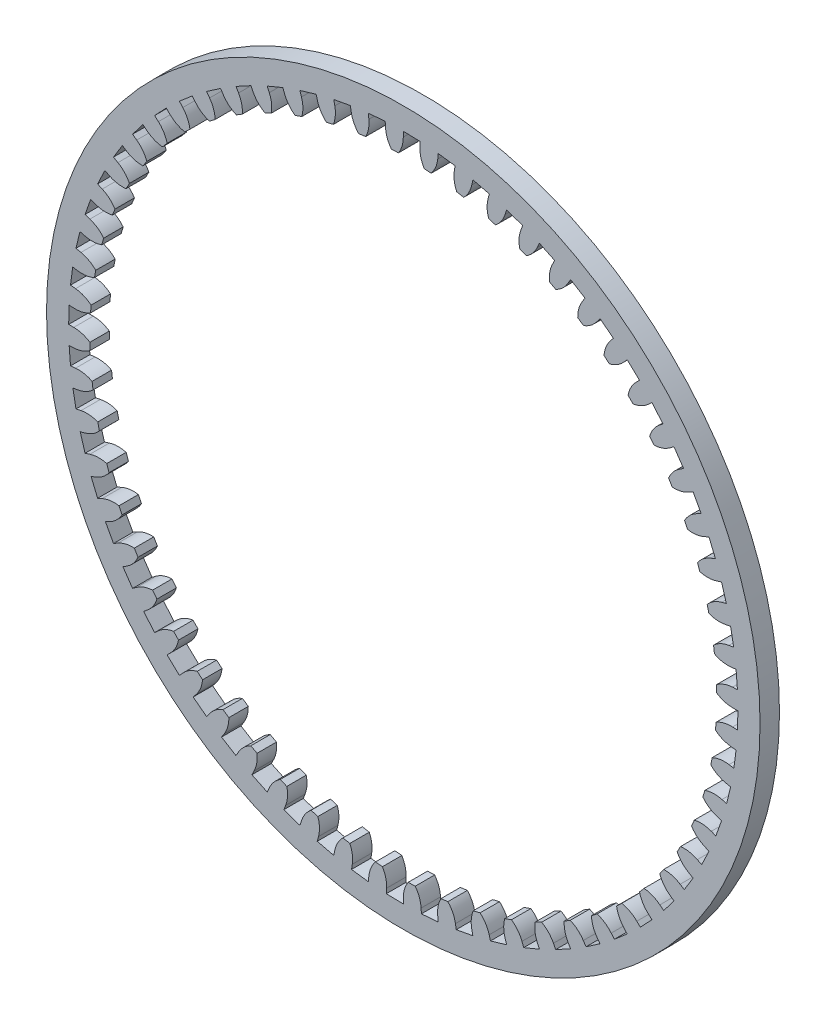
from build123d import *
from OCP.BRepFilletAPI import BRepFilletAPI_MakeChamfer

# Parameters (mm, degrees)
BOSS_EXTRUDE1_DEPTH = 4
CHAMFER1_SIZE       = 1
CHAMFER1_SIZE2      = 1.02816492
CHAMFER1_SIZE2_2    = 1.028164498
CHAMFER1_SIZE2_3    = 1.028165221
FILLET1_R           = 6
CIRPATTERN6_DEPTH   = 4


# Read off the part's stored shape, not the designer's step: CirPattern6
with BuildPart() as part:
    # Sketch2 → Boss-Extrude1 (new body)
    with BuildSketch(Plane.XY):
        with BuildLine():
            Line((0, 73.473375946), (0, 64.57))
            Line((0, 64.57), (-3.489128905, 64.47566114))
            Line((-3.489128905, 64.47566114), (-3.7236451, 68.809320351))
            Line((-3.7236451, 68.809320351), (-7.203054967, 68.532503961))
            Line((-7.203054967, 68.532503961), (-6.749402648, 64.216278808))
            Line((-6.749402648, 64.216278808), (-10.209556645, 63.757743476))
            Line((-10.209556645, 63.757743476), (-10.895780524, 68.043148566))
            Line((-10.895780524, 68.043148566), (-14.327194614, 67.404151167))
            Line((-14.327194614, 67.404151167), (-15.275973823, 71.867806399))
            ThreePointArc((-15.275973823, 71.867806399), (-7.680059079, 73.070881105), (0, 73.473375946))
        make_face()
    extrude(amount=BOSS_EXTRUDE1_DEPTH)

    # Chamfer1: one chamfer whose edges measure the first distance from different faces: ONE call of the kernel's chamfer builder (chamfer() names one face for all edges)
    chamfer1_edges_1 = [part.edges().sort_by_distance(p)[0] for p in [
        (0, 64.57, 2),
    ]]
    chamfer1_side_1 = [part.faces().sort_by_distance(p)[0] for p in [
        (-1.744564453, 64.52283057, 2),
    ]]
    chamfer1_edges_2 = [part.edges().sort_by_distance(p)[0] for p in [
        (-3.489128905, 64.47566114, 2),
    ]]
    chamfer1_side_2 = [part.faces().sort_by_distance(p)[0] for p in [
        (-3.606387002, 66.642490746, 2),
    ]]
    chamfer1_edges_3 = [part.edges().sort_by_distance(p)[0] for p in [
        (-6.749402648, 64.216278808, 2),
    ]]
    chamfer1_side_3 = [part.faces().sort_by_distance(p)[0] for p in [
        (-8.479479646, 63.987011142, 2),
    ]]
    chamfer1_edges_4 = [part.edges().sort_by_distance(p)[0] for p in [
        (-10.209556645, 63.757743476, 2),
    ]]
    chamfer1_side_4 = [part.faces().sort_by_distance(p)[0] for p in [
        (-10.552668584, 65.900446021, 2),
    ]]
    chamfer1 = BRepFilletAPI_MakeChamfer(part.part.solid().wrapped)
    for e in chamfer1_edges_1:
        chamfer1.Add(CHAMFER1_SIZE, CHAMFER1_SIZE2, e.wrapped, chamfer1_side_1[0].wrapped)  # the first distance lies on this face
    for e in chamfer1_edges_2:
        chamfer1.Add(CHAMFER1_SIZE, CHAMFER1_SIZE2_2, e.wrapped, chamfer1_side_2[0].wrapped)  # the first distance lies on this face
    for e in chamfer1_edges_3:
        chamfer1.Add(CHAMFER1_SIZE, CHAMFER1_SIZE2_3, e.wrapped, chamfer1_side_3[0].wrapped)  # the first distance lies on this face
    for e in chamfer1_edges_4:
        chamfer1.Add(CHAMFER1_SIZE, CHAMFER1_SIZE2, e.wrapped, chamfer1_side_4[0].wrapped)  # the first distance lies on this face
    add(Compound.cast(chamfer1.Shape()), mode=Mode.REPLACE)

    # Fillet1
    # the kernel refuses this fillet: 6 mm, written as the material it takes off along each edge
    with BuildSketch(Plane(origin=(0, 65.59816492, -5.652202484), x_dir=(0, 1, 0), z_dir=(0, 0, 1))) as fillet1_piece_1:
        with BuildLine():
            CenterArc((2.260880994, 6), FILLET1_R, 236.449001868, 33.550998132)
            Line((-1.055192983, 0.999634675), (-1.121514463, 0.899627369))
            ThreePointArc((-1.121514463, 0.899627369), (-0.610124899, 0.412702116), (-0.082528408, -0.087115222))
            Line((-0.082528408, -0.087115222), (0, -0.12))
            Line((0, -0.12), (2.260880994, -0.12))
            Line((2.260880994, -0.12), (2.260880994, 0))
        make_face()
    extrude(amount=15.304404968, mode=Mode.SUBTRACT)
    with BuildSketch(Plane(origin=(-3.543164895, 65.474200129, -5.825882404), x_dir=(0.7442829047789902, -0.6678644755141188, 0), z_dir=(0, 0, 1))) as fillet1_piece_2:
        with BuildLine():
            CenterArc((2.594832306, 5.890449069), FILLET1_R, 225, 34.034383283)
            Line((-1.647808382, 1.647808382), (-1.732661195, 1.562955568))
            Line((-1.732661195, 1.562955568), (-0.084852814, -0.084852814))
            Line((-0.084852814, -0.084852814), (0, -0.12))
            ThreePointArc((0, -0.12), (0.726756497, -0.12), (1.430686609, -0.117808981))
            Line((1.430686609, -0.117808981), (1.453512995, 0))
        make_face()
    extrude(amount=15.651764807, mode=Mode.SUBTRACT)
    with BuildSketch(Plane(origin=(-6.856874891, 65.238811662, -5.652201011), x_dir=(-0.10452818418191513, 0.9945219247013267, 0), z_dir=(0, 0, 1))) as fillet1_piece_3:
        with BuildLine():
            CenterArc((2.260880404, 6), FILLET1_R, 236.449001998, 33.550998002)
            Line((-1.055193561, 0.999634668), (-1.12151504, 0.899627361))
            ThreePointArc((-1.12151504, 0.899627361), (-0.610125164, 0.412702089), (-0.082528384, -0.087115245))
            Line((-0.082528384, -0.087115245), (0, -0.12))
            Line((0, -0.12), (2.260880404, -0.12))
            Line((2.260880404, -0.12), (2.260880404, 0))
        make_face()
    extrude(amount=15.304402022, mode=Mode.SUBTRACT)
    with BuildSketch(Plane(origin=(-10.367672746, 64.745164003, -5.825882897), x_dir=(-0.15811610105493576, 0.987420527732326, 0), z_dir=(0, 0, 1))) as fillet1_piece_4:
        with BuildLine():
            CenterArc((2.330353159, -6), FILLET1_R, 90, 34.034390293)
            Line((-1.027789306, -1.027789306), (-1.094952155, -0.928345092))
            ThreePointArc((-1.094952155, -0.928345092), (-0.598747467, -0.429041839), (-0.084852814, 0.084852814))
            Line((-0.084852814, 0.084852814), (0, 0.12))
            Line((0, 0.12), (2.330353159, 0.12))
            Line((2.330353159, 0.12), (2.330353159, 0))
        make_face()
    extrude(amount=15.651765795, mode=Mode.SUBTRACT)

    # CirPattern6 outline → CirPattern6 (add)
    with BuildSketch(Plane.XY):
        with BuildLine():
            ThreePointArc((-15.275973823, 71.867806399), (7.680059079, -73.070881105), (0, 73.473375946))
            Line((0, 73.473375946), (0, 68.91))
            Line((0, 68.91), (3.48928449, 68.821602668))
            Line((3.48928449, 68.821602668), (3.438160631, 67.813250996))
            ThreePointArc((3.438160631, 67.813250996), (3.611608516, 66.046249556), (4.294590654, 64.407373827))
            Line((4.294590654, 64.407373827), (5.752419325, 64.29388904))
            ThreePointArc((5.752419325, 64.29388904), (6.658243721, 65.791749408), (7.093202902, 67.487306553))
            Line((7.093202902, 67.487306553), (7.203057841, 68.532503659))
            Line((7.203057841, 68.532503659), (10.663987618, 68.079860958))
            Line((10.663987618, 68.079860958), (10.507741956, 67.082376905))
            ThreePointArc((10.507741956, 67.082376905), (10.495536995, 65.306925411), (11.003467608, 63.605636647))
            Line((11.003467608, 63.605636647), (12.441448167, 63.34038888))
            ThreePointArc((12.441448167, 63.34038888), (13.498879019, 64.735359681), (14.108688973, 66.376162949))
            Line((14.108688973, 66.376162949), (14.327194614, 67.404151167))
            Line((14.327194614, 67.404151167), (17.721851027, 66.59222249))
            Line((17.721851027, 66.59222249), (17.462196247, 65.616534969))
            ThreePointArc((17.462196247, 65.616534969), (17.264473622, 63.852084907), (17.591789537, 62.107022574))
            Line((17.591789537, 62.107022574), (18.994166341, 61.692918078))
            ThreePointArc((18.994166341, 61.692918078), (20.191618982, 62.969715122), (20.969599414, 64.537787176))
            Line((20.969599414, 64.537787176), (21.294362456, 65.537304091))
            Line((21.294362456, 65.537304091), (24.585552905, 64.374984958))
            Line((24.585552905, 64.374984958), (24.22533299, 63.431783625))
            ThreePointArc((24.22533299, 63.431783625), (23.844257614, 61.697667561), (23.987370901, 59.927951325))
            Line((23.987370901, 59.927951325), (25.338780023, 59.369526888))
            ThreePointArc((25.338780023, 59.369526888), (26.663134212, 60.514161994), (27.600760537, 61.992323154))
            Line((27.600760537, 61.992323154), (28.028222074, 62.952417486))
            Line((28.028222074, 62.952417486), (31.179887636, 61.452442645))
            Line((31.179887636, 61.452442645), (30.723050093, 60.552061501))
            ThreePointArc((30.723050093, 60.552061501), (30.162798387, 58.867277752), (30.120142804, 57.092296412))
            Line((30.120142804, 57.092296412), (31.405777144, 56.395670561))
            ThreePointArc((31.405777144, 56.395670561), (32.842523604, 57.395602123), (33.929523809, 58.767656813))
            Line((33.929523809, 58.767656813), (34.455001251, 59.677809852))
            Line((34.455001251, 59.677809852), (37.432611556, 57.85661321))
            Line((37.432611556, 57.85661321), (36.884160726, 57.00891702))
            ThreePointArc((36.884160726, 57.00891702), (36.150869759, 55.391925578), (35.922910982, 53.631126963))
            Line((35.922910982, 53.631126963), (37.128685603, 52.803931684))
            ThreePointArc((37.128685603, 52.803931684), (38.662082496, 53.648205048), (39.886546423, 54.899121366))
            Line((39.886546423, 54.899121366), (40.504281735, 55.749361082))
            Line((40.504281735, 55.749361082), (43.275213537, 53.626896174))
            Line((43.275213537, 53.626896174), (42.641159225, 52.841172385))
            ThreePointArc((42.641159225, 52.841172385), (41.742864125, 51.309688082), (41.332101297, 49.582362938))
            Line((41.332101297, 49.582362938), (42.444804783, 48.633661623))
            ThreePointArc((42.444804783, 48.633661623), (44.058052348, 49.313025896), (45.406565201, 50.429097849))
            Line((45.406565201, 50.429097849), (46.109791158, 51.210108957))
            Line((46.109791158, 51.210108957), (48.64368546, 48.809629837))
            Line((48.64368546, 48.809629837), (47.930973649, 48.094487183))
            ThreePointArc((47.930973649, 48.094487183), (46.877515423, 46.665290648), (46.288447476, 44.990365002))
            Line((46.288447476, 44.990365002), (47.29588946, 43.930551285))
            ThreePointArc((47.29588946, 43.930551285), (48.971312254, 44.437564109), (50.429098833, 45.406564539))
            Line((50.429098833, 45.406564539), (51.210109924, 46.109790084))
            Line((51.210109924, 46.109790084), (53.47920495, 43.457597011))
            Line((53.47920495, 43.457597011), (52.695645084, 42.820870475))
            ThreePointArc((52.695645084, 42.820870475), (51.498566396, 41.509618832), (50.73764863, 39.905442281))
            Line((50.73764863, 39.905442281), (51.628790781, 38.746128303))
            ThreePointArc((51.628790781, 38.746128303), (53.34803279, 39.075233807), (54.899121809, 39.886545323))
            Line((54.899121809, 39.886545323), (55.749361932, 40.504280567))
            Line((55.749361932, 40.504280567), (57.728796891, 37.629431427))
            Line((57.728796891, 37.629431427), (56.882973024, 37.078097473))
            ThreePointArc((56.882973024, 37.078097473), (55.555388721, 35.899158592), (54.630956698, 34.383308203))
            Line((54.630956698, 34.383308203), (55.396035996, 33.137194992))
            ThreePointArc((55.396035996, 33.137194992), (57.140260676, 33.284788384), (58.767657638, 33.929522957))
            Line((58.767657638, 33.929522957), (59.677810575, 34.455))
            Line((59.677810575, 34.455), (61.345898484, 31.388992325))
            Line((61.345898484, 31.388992325), (60.447078391, 30.929091049))
            ThreePointArc((60.447078391, 30.929091049), (59.003534198, 29.895380054), (57.925717252, 28.484462308))
            Line((57.925717252, 28.484462308), (58.556350879, 27.165203251))
            ThreePointArc((58.556350879, 27.165203251), (60.306448208, 27.129666497), (61.992323359, 27.60075937))
            Line((61.992323359, 27.60075937), (62.952418074, 28.028220754))
            Line((62.952418074, 28.028220754), (64.290882885, 24.804646296))
            Line((64.290882885, 24.804646296), (63.348913524, 24.441216982))
            ThreePointArc((63.348913524, 24.441216982), (61.805224947, 23.564061042), (60.585830964, 22.273535846))
            Line((60.585830964, 22.273535846), (61.075109939, 20.895584268))
            ThreePointArc((61.075109939, 20.895584268), (62.811905516, 20.677307687), (64.537787806, 20.969598409))
            Line((64.537787806, 20.969598409), (65.537304538, 21.294361082))
            Line((65.537304538, 21.294361082), (66.531481884, 17.948538053))
            Line((66.531481884, 17.948538053), (65.556684315, 17.685561929))
            ThreePointArc((65.556684315, 17.685561929), (63.929764425, 16.974569714), (62.582154071, 15.818574649))
            Line((62.582154071, 15.818574649), (62.92471746, 14.397028464))
            ThreePointArc((62.92471746, 14.397028464), (64.629182456, 13.998402579), (66.376162906, 14.108687789))
            Line((66.376162906, 14.108687789), (67.404151467, 14.327193201))
            Line((67.404151467, 14.327193201), (68.043148794, 10.895779097))
            Line((68.043148794, 10.895779097), (67.046202521, 10.736138028))
            ThreePointArc((67.046202521, 10.736138028), (65.353876268, 10.199100952), (63.892813694, 9.190303092))
            Line((63.892813694, 9.190303092), (64.084908507, 7.740736243))
            ThreePointArc((64.084908507, 7.740736243), (65.738368681, 7.166129425), (67.48730696, 7.093201788))
            Line((67.48730696, 7.093201788), (68.53250381, 7.203056404))
            Line((68.53250381, 7.203056404), (68.809320273, 3.723646542))
            Line((68.809320273, 3.723646542), (67.801148558, 3.669088888))
            ThreePointArc((67.801148558, 3.669088888), (66.061957178, 3.311889224), (64.503450455, 2.461339372))
            Line((64.503450455, 2.461339372), (64.542971941, 0.999634448))
            ThreePointArc((64.542971941, 0.999634448), (66.127311306, 0.255341296), (67.859045625, -1.15e-06))
            Line((67.859045625, -1.15e-06), (68.91, -1.445e-06))
            Line((68.91, -1.445e-06), (68.821602595, -3.489285932))
            Line((68.821602595, -3.489285932), (67.813250745, -3.438161676))
            ThreePointArc((67.813250745, -3.438161676), (66.046249594, -3.611608791), (64.407373874, -4.294590007))
            Line((64.407373874, -4.294590007), (64.29388906, -5.752419099))
            ThreePointArc((64.29388906, -5.752419099), (65.791749687, -6.658243081), (67.48730696, -7.093201788))
            Line((67.48730696, -7.093201788), (68.53250381, -7.203056404))
            Line((68.53250381, -7.203056404), (68.079861182, -10.663986191))
            Line((68.079861182, -10.663986191), (67.082377264, -10.507740944))
            ThreePointArc((67.082377264, -10.507740944), (65.306925402, -10.495536718), (63.605636532, -11.003468246))
            Line((63.605636532, -11.003468246), (63.340388836, -12.441448389))
            ThreePointArc((63.340388836, -12.441448389), (64.735359337, -13.498879627), (66.376162428, -14.108690038))
            Line((66.376162428, -14.108690038), (67.404150866, -14.327196027))
            Line((67.404150866, -14.327196027), (66.592222119, -17.721852423))
            Line((66.592222119, -17.721852423), (65.616534507, -17.462197216))
            ThreePointArc((65.616534507, -17.462197216), (63.852084888, -17.264473899), (62.107022755, -17.591788915))
            Line((62.107022755, -17.591788915), (61.692918145, -18.994166124))
            ThreePointArc((61.692918145, -18.994166124), (62.969715528, -20.191618414), (64.537787806, -20.969598409))
            Line((64.537787806, -20.969598409), (65.537304538, -21.294361082))
            Line((65.537304538, -21.294361082), (64.374985474, -24.585551555))
            Line((64.374985474, -24.585551555), (63.431784186, -24.225332074))
            ThreePointArc((63.431784186, -24.225332074), (61.697667608, -23.844257341), (59.927951079, -23.987371501))
            Line((59.927951079, -23.987371501), (59.369526799, -25.338780232))
            ThreePointArc((59.369526799, -25.338780232), (60.514161531, -26.663134735), (61.992322423, -27.60076147))
            Line((61.992322423, -27.60076147), (62.952416899, -28.028223394))
            Line((62.952416899, -28.028223394), (61.452441991, -31.179888924))
            Line((61.452441991, -31.179888924), (60.552060847, -30.723050946))
            ThreePointArc((60.552060847, -30.723050946), (58.867277676, -30.162798653), (57.092296719, -30.120142232))
            Line((57.092296719, -30.120142232), (56.395670671, -31.405776945))
            ThreePointArc((56.395670671, -31.405776945), (57.395602637, -32.842523132), (58.767657638, -33.929522957))
            Line((58.767657638, -33.929522957), (59.677810575, -34.455))
            Line((59.677810575, -34.455), (57.856613995, -37.432610343))
            Line((57.856613995, -37.432610343), (57.00891776, -36.884159947))
            ThreePointArc((57.00891776, -36.884159947), (55.391925682, -36.150869502), (53.631126598, -35.922911518))
            Line((53.631126598, -35.922911518), (52.803931554, -37.128685789))
            ThreePointArc((52.803931554, -37.128685789), (53.648204487, -38.662082911), (54.899120457, -39.886547184))
            Line((54.899120457, -39.886547184), (55.749360233, -40.504282904))
            Line((55.749360233, -40.504282904), (53.626895267, -43.275214662))
            Line((53.626895267, -43.275214662), (52.841171568, -42.641159923))
            ThreePointArc((52.841171568, -42.641159923), (51.309687952, -41.74286437), (49.582363357, -41.332100802))
            Line((49.582363357, -41.332100802), (48.633661772, -42.444804612))
            ThreePointArc((48.633661772, -42.444804612), (49.313026497, -44.058051994), (50.429098833, -45.406564539))
            Line((50.429098833, -45.406564539), (51.210109924, -46.109790084))
            Line((51.210109924, -46.109790084), (48.809630857, -48.643684437))
            Line((48.809630857, -48.643684437), (48.094488068, -47.93097304))
            ThreePointArc((48.094488068, -47.93097304), (46.665290803, -46.877515194), (44.990364534, -46.288447924))
            Line((44.990364534, -46.288447924), (43.930551119, -47.295889614))
            ThreePointArc((43.930551119, -47.295889614), (44.437563474, -48.971312543), (45.406563492, -50.429099388))
            Line((45.406563492, -50.429099388), (46.109789011, -51.21011089))
            Line((46.109789011, -51.21011089), (43.457595889, -53.479205861))
            Line((43.457595889, -53.479205861), (42.820869531, -52.695645597))
            ThreePointArc((42.820869531, -52.695645597), (41.509618654, -51.498566608), (39.905442793, -50.737648233))
            Line((39.905442793, -50.737648233), (38.746128484, -51.628790645))
            ThreePointArc((38.746128484, -51.628790645), (39.075234469, -53.348032569), (39.886546423, -54.899121366))
            Line((39.886546423, -54.899121366), (40.504281735, -55.749361082))
            Line((40.504281735, -55.749361082), (37.629432637, -57.728796102))
            Line((37.629432637, -57.728796102), (37.078098465, -56.882972613))
            ThreePointArc((37.078098465, -56.882972613), (35.899158791, -55.555388528), (34.383307651, -54.63095704))
            Line((34.383307651, -54.63095704), (33.137194797, -55.396036112))
            ThreePointArc((33.137194797, -55.396036112), (33.284787702, -57.140260826), (33.929521817, -58.767657963))
            Line((33.929521817, -58.767657963), (34.454998749, -59.677811297))
            Line((34.454998749, -59.677811297), (31.388991039, -61.345899142))
            Line((31.388991039, -61.345899142), (30.929090019, -60.447078696))
            ThreePointArc((30.929090019, -60.447078696), (29.895379836, -59.003534369), (28.484462892, -57.92571697))
            Line((28.484462892, -57.92571697), (27.165203457, -58.556350784))
            ThreePointArc((27.165203457, -58.556350784), (27.129667191, -60.306448129), (27.600760537, -61.992323154))
            Line((27.600760537, -61.992323154), (28.028222074, -62.952417486))
            Line((28.028222074, -62.952417486), (24.804647644, -64.290882365))
            Line((24.804647644, -64.290882365), (24.441218038, -63.348913329))
            ThreePointArc((24.441218038, -63.348913329), (23.564061277, -61.8052248), (22.273535235, -60.585831184))
            Line((22.273535235, -60.585831184), (20.895584053, -61.075110013))
            ThreePointArc((20.895584053, -61.075110013), (20.677306989, -62.811905523), (20.969597227, -64.537787887))
            Line((20.969597227, -64.537787887), (21.294359708, -65.537304984))
            Line((21.294359708, -65.537304984), (17.948536659, -66.531482261))
            Line((17.948536659, -66.531482261), (17.685560858, -65.556684399))
            ThreePointArc((17.685560858, -65.556684399), (16.974569465, -63.929764547), (15.818575279, -62.582153917))
            Line((15.818575279, -62.582153917), (14.397028685, -62.924717409))
            ThreePointArc((14.397028685, -62.924717409), (13.998403274, -64.629182523), (14.108688973, -66.376162949))
            Line((14.108688973, -66.376162949), (14.327194614, -67.404151167))
            Line((14.327194614, -67.404151167), (10.895780524, -68.043148566))
            Line((10.895780524, -68.043148566), (10.736139102, -67.046202549))
            ThreePointArc((10.736139102, -67.046202549), (10.199101212, -65.353876174), (9.190302449, -63.892813782))
            Line((9.190302449, -63.892813782), (7.740736018, -64.084908534))
            ThreePointArc((7.740736018, -64.084908534), (7.166128741, -65.738368542), (7.093200614, -67.487306793))
            Line((7.093200614, -67.487306793), (7.203054967, -68.532503961))
            Line((7.203054967, -68.532503961), (3.7236451, -68.809320351))
            Line((3.7236451, -68.809320351), (3.669087823, -67.801148418))
            ThreePointArc((3.669087823, -67.801148418), (3.311888955, -66.061957245), (2.461340021, -64.503450435))
            Line((2.461340021, -64.503450435), (0.999634675, -64.542971937))
            ThreePointArc((0.999634675, -64.542971937), (0.255341962, -66.127311516), (0, -67.859045914))
            Line((0, -67.859045914), (0, -68.91))
            Line((0, -68.91), (-3.48928449, -68.821602668))
            Line((-3.48928449, -68.821602668), (-3.438160631, -67.813250996))
            ThreePointArc((-3.438160631, -67.813250996), (-3.611608516, -66.046249556), (-4.294590654, -64.407373827))
            Line((-4.294590654, -64.407373827), (-5.752419325, -64.29388904))
            ThreePointArc((-5.752419325, -64.29388904), (-6.658243721, -65.791749408), (-7.093202902, -67.487306553))
            Line((-7.093202902, -67.487306553), (-7.203057841, -68.532503659))
            Line((-7.203057841, -68.532503659), (-10.663987618, -68.079860958))
            Line((-10.663987618, -68.079860958), (-10.507741956, -67.082376905))
            ThreePointArc((-10.507741956, -67.082376905), (-10.495536995, -65.306925411), (-11.003467608, -63.605636647))
            Line((-11.003467608, -63.605636647), (-12.441448167, -63.34038888))
            ThreePointArc((-12.441448167, -63.34038888), (-13.498879019, -64.735359681), (-14.108688973, -66.376162949))
            Line((-14.108688973, -66.376162949), (-14.327194614, -67.404151167))
            Line((-14.327194614, -67.404151167), (-17.721851027, -66.59222249))
            Line((-17.721851027, -66.59222249), (-17.462196247, -65.616534969))
            ThreePointArc((-17.462196247, -65.616534969), (-17.264473622, -63.852084907), (-17.591789537, -62.107022574))
            Line((-17.591789537, -62.107022574), (-18.994166341, -61.692918078))
            ThreePointArc((-18.994166341, -61.692918078), (-20.191618982, -62.969715122), (-20.969599414, -64.537787176))
            Line((-20.969599414, -64.537787176), (-21.294362456, -65.537304091))
            Line((-21.294362456, -65.537304091), (-24.585552905, -64.374984958))
            Line((-24.585552905, -64.374984958), (-24.22533299, -63.431783625))
            ThreePointArc((-24.22533299, -63.431783625), (-23.844257614, -61.697667561), (-23.987370901, -59.927951325))
            Line((-23.987370901, -59.927951325), (-25.338780023, -59.369526888))
            ThreePointArc((-25.338780023, -59.369526888), (-26.663134212, -60.514161994), (-27.600760537, -61.992323154))
            Line((-27.600760537, -61.992323154), (-28.028222074, -62.952417486))
            Line((-28.028222074, -62.952417486), (-31.179887636, -61.452442645))
            Line((-31.179887636, -61.452442645), (-30.723050093, -60.552061501))
            ThreePointArc((-30.723050093, -60.552061501), (-30.162798387, -58.867277752), (-30.120142804, -57.092296412))
            Line((-30.120142804, -57.092296412), (-31.405777144, -56.395670561))
            ThreePointArc((-31.405777144, -56.395670561), (-32.842523604, -57.395602123), (-33.929523809, -58.767656813))
            Line((-33.929523809, -58.767656813), (-34.455001251, -59.677809852))
            Line((-34.455001251, -59.677809852), (-37.432611556, -57.85661321))
            Line((-37.432611556, -57.85661321), (-36.884160726, -57.00891702))
            ThreePointArc((-36.884160726, -57.00891702), (-36.150869759, -55.391925578), (-35.922910982, -53.631126963))
            Line((-35.922910982, -53.631126963), (-37.128685603, -52.803931684))
            ThreePointArc((-37.128685603, -52.803931684), (-38.662082496, -53.648205048), (-39.886546423, -54.899121366))
            Line((-39.886546423, -54.899121366), (-40.504281735, -55.749361082))
            Line((-40.504281735, -55.749361082), (-43.275213537, -53.626896174))
            Line((-43.275213537, -53.626896174), (-42.641159225, -52.841172385))
            ThreePointArc((-42.641159225, -52.841172385), (-41.742864125, -51.309688082), (-41.332101297, -49.582362938))
            Line((-41.332101297, -49.582362938), (-42.444804783, -48.633661623))
            ThreePointArc((-42.444804783, -48.633661623), (-44.058052348, -49.313025896), (-45.406565201, -50.429097849))
            Line((-45.406565201, -50.429097849), (-46.109791158, -51.210108957))
            Line((-46.109791158, -51.210108957), (-48.64368546, -48.809629837))
            Line((-48.64368546, -48.809629837), (-47.930973649, -48.094487183))
            ThreePointArc((-47.930973649, -48.094487183), (-46.877515423, -46.665290648), (-46.288447476, -44.990365002))
            Line((-46.288447476, -44.990365002), (-47.29588946, -43.930551285))
            ThreePointArc((-47.29588946, -43.930551285), (-48.971312254, -44.437564109), (-50.429098833, -45.406564539))
            Line((-50.429098833, -45.406564539), (-51.210109924, -46.109790084))
            Line((-51.210109924, -46.109790084), (-53.47920495, -43.457597011))
            Line((-53.47920495, -43.457597011), (-52.695645084, -42.820870475))
            ThreePointArc((-52.695645084, -42.820870475), (-51.498566396, -41.509618832), (-50.73764863, -39.905442281))
            Line((-50.73764863, -39.905442281), (-51.628790781, -38.746128303))
            ThreePointArc((-51.628790781, -38.746128303), (-53.34803279, -39.075233807), (-54.899121809, -39.886545323))
            Line((-54.899121809, -39.886545323), (-55.749361932, -40.504280567))
            Line((-55.749361932, -40.504280567), (-57.728796891, -37.629431427))
            Line((-57.728796891, -37.629431427), (-56.882973024, -37.078097473))
            ThreePointArc((-56.882973024, -37.078097473), (-55.555388721, -35.899158592), (-54.630956698, -34.383308203))
            Line((-54.630956698, -34.383308203), (-55.396035996, -33.137194992))
            ThreePointArc((-55.396035996, -33.137194992), (-57.140260676, -33.284788384), (-58.767657638, -33.929522957))
            Line((-58.767657638, -33.929522957), (-59.677810575, -34.455))
            Line((-59.677810575, -34.455), (-61.345898484, -31.388992325))
            Line((-61.345898484, -31.388992325), (-60.447078391, -30.929091049))
            ThreePointArc((-60.447078391, -30.929091049), (-59.003534198, -29.895380054), (-57.925717252, -28.484462308))
            Line((-57.925717252, -28.484462308), (-58.556350879, -27.165203251))
            ThreePointArc((-58.556350879, -27.165203251), (-60.306448208, -27.129666497), (-61.992323359, -27.60075937))
            Line((-61.992323359, -27.60075937), (-62.952418074, -28.028220754))
            Line((-62.952418074, -28.028220754), (-64.290882885, -24.804646296))
            Line((-64.290882885, -24.804646296), (-63.348913524, -24.441216982))
            ThreePointArc((-63.348913524, -24.441216982), (-61.805224947, -23.564061042), (-60.585830964, -22.273535846))
            Line((-60.585830964, -22.273535846), (-61.075109939, -20.895584268))
            ThreePointArc((-61.075109939, -20.895584268), (-62.811905516, -20.677307687), (-64.537787806, -20.969598409))
            Line((-64.537787806, -20.969598409), (-65.537304538, -21.294361082))
            Line((-65.537304538, -21.294361082), (-66.531481884, -17.948538053))
            Line((-66.531481884, -17.948538053), (-65.556684315, -17.685561929))
            ThreePointArc((-65.556684315, -17.685561929), (-63.929764425, -16.974569714), (-62.582154071, -15.818574649))
            Line((-62.582154071, -15.818574649), (-62.92471746, -14.397028464))
            ThreePointArc((-62.92471746, -14.397028464), (-64.629182456, -13.998402579), (-66.376162906, -14.108687789))
            Line((-66.376162906, -14.108687789), (-67.404151467, -14.327193201))
            Line((-67.404151467, -14.327193201), (-68.043148794, -10.895779097))
            Line((-68.043148794, -10.895779097), (-67.046202521, -10.736138028))
            ThreePointArc((-67.046202521, -10.736138028), (-65.353876268, -10.199100952), (-63.892813694, -9.190303092))
            Line((-63.892813694, -9.190303092), (-64.084908507, -7.740736243))
            ThreePointArc((-64.084908507, -7.740736243), (-65.738368681, -7.166129425), (-67.48730696, -7.093201788))
            Line((-67.48730696, -7.093201788), (-68.53250381, -7.203056404))
            Line((-68.53250381, -7.203056404), (-68.809320273, -3.723646542))
            Line((-68.809320273, -3.723646542), (-67.801148558, -3.669088888))
            ThreePointArc((-67.801148558, -3.669088888), (-66.061957178, -3.311889224), (-64.503450455, -2.461339372))
            Line((-64.503450455, -2.461339372), (-64.542971941, -0.999634448))
            ThreePointArc((-64.542971941, -0.999634448), (-66.127311306, -0.255341296), (-67.859045625, 1.15e-06))
            Line((-67.859045625, 1.15e-06), (-68.91, 1.445e-06))
            Line((-68.91, 1.445e-06), (-68.821602595, 3.489285932))
            Line((-68.821602595, 3.489285932), (-67.813250745, 3.438161676))
            ThreePointArc((-67.813250745, 3.438161676), (-66.046249594, 3.611608791), (-64.407373874, 4.294590007))
            Line((-64.407373874, 4.294590007), (-64.29388906, 5.752419099))
            ThreePointArc((-64.29388906, 5.752419099), (-65.791749687, 6.658243081), (-67.48730696, 7.093201788))
            Line((-67.48730696, 7.093201788), (-68.53250381, 7.203056404))
            Line((-68.53250381, 7.203056404), (-68.079861182, 10.663986191))
            Line((-68.079861182, 10.663986191), (-67.082377264, 10.507740944))
            ThreePointArc((-67.082377264, 10.507740944), (-65.306925402, 10.495536718), (-63.605636532, 11.003468246))
            Line((-63.605636532, 11.003468246), (-63.340388836, 12.441448389))
            ThreePointArc((-63.340388836, 12.441448389), (-64.735359337, 13.498879627), (-66.376162428, 14.108690038))
            Line((-66.376162428, 14.108690038), (-67.404150866, 14.327196027))
            Line((-67.404150866, 14.327196027), (-66.592222119, 17.721852423))
            Line((-66.592222119, 17.721852423), (-65.616534507, 17.462197216))
            ThreePointArc((-65.616534507, 17.462197216), (-63.852084888, 17.264473899), (-62.107022755, 17.591788915))
            Line((-62.107022755, 17.591788915), (-61.692918145, 18.994166124))
            ThreePointArc((-61.692918145, 18.994166124), (-62.969715528, 20.191618414), (-64.537787806, 20.969598409))
            Line((-64.537787806, 20.969598409), (-65.537304538, 21.294361082))
            Line((-65.537304538, 21.294361082), (-64.374985474, 24.585551555))
            Line((-64.374985474, 24.585551555), (-63.431784186, 24.225332074))
            ThreePointArc((-63.431784186, 24.225332074), (-61.697667608, 23.844257341), (-59.927951079, 23.987371501))
            Line((-59.927951079, 23.987371501), (-59.369526799, 25.338780232))
            ThreePointArc((-59.369526799, 25.338780232), (-60.514161531, 26.663134735), (-61.992322423, 27.60076147))
            Line((-61.992322423, 27.60076147), (-62.952416899, 28.028223394))
            Line((-62.952416899, 28.028223394), (-61.452441991, 31.179888924))
            Line((-61.452441991, 31.179888924), (-60.552060847, 30.723050946))
            ThreePointArc((-60.552060847, 30.723050946), (-58.867277676, 30.162798653), (-57.092296719, 30.120142232))
            Line((-57.092296719, 30.120142232), (-56.395670671, 31.405776945))
            ThreePointArc((-56.395670671, 31.405776945), (-57.395602637, 32.842523132), (-58.767657638, 33.929522957))
            Line((-58.767657638, 33.929522957), (-59.677810575, 34.455))
            Line((-59.677810575, 34.455), (-57.856613995, 37.432610343))
            Line((-57.856613995, 37.432610343), (-57.00891776, 36.884159947))
            ThreePointArc((-57.00891776, 36.884159947), (-55.391925682, 36.150869502), (-53.631126598, 35.922911518))
            Line((-53.631126598, 35.922911518), (-52.803931554, 37.128685789))
            ThreePointArc((-52.803931554, 37.128685789), (-53.648204487, 38.662082911), (-54.899120457, 39.886547184))
            Line((-54.899120457, 39.886547184), (-55.749360233, 40.504282904))
            Line((-55.749360233, 40.504282904), (-53.626895267, 43.275214662))
            Line((-53.626895267, 43.275214662), (-52.841171568, 42.641159923))
            ThreePointArc((-52.841171568, 42.641159923), (-51.309687952, 41.74286437), (-49.582363357, 41.332100802))
            Line((-49.582363357, 41.332100802), (-48.633661772, 42.444804612))
            ThreePointArc((-48.633661772, 42.444804612), (-49.313026497, 44.058051994), (-50.429098833, 45.406564539))
            Line((-50.429098833, 45.406564539), (-51.210109924, 46.109790084))
            Line((-51.210109924, 46.109790084), (-48.809630857, 48.643684437))
            Line((-48.809630857, 48.643684437), (-48.094488068, 47.93097304))
            ThreePointArc((-48.094488068, 47.93097304), (-46.665290803, 46.877515194), (-44.990364534, 46.288447924))
            Line((-44.990364534, 46.288447924), (-43.930551119, 47.295889614))
            ThreePointArc((-43.930551119, 47.295889614), (-44.437563474, 48.971312543), (-45.406563492, 50.429099388))
            Line((-45.406563492, 50.429099388), (-46.109789011, 51.21011089))
            Line((-46.109789011, 51.21011089), (-43.457595889, 53.479205861))
            Line((-43.457595889, 53.479205861), (-42.820869531, 52.695645597))
            ThreePointArc((-42.820869531, 52.695645597), (-41.509618654, 51.498566608), (-39.905442793, 50.737648233))
            Line((-39.905442793, 50.737648233), (-38.746128484, 51.628790645))
            ThreePointArc((-38.746128484, 51.628790645), (-39.075234469, 53.348032569), (-39.886546423, 54.899121366))
            Line((-39.886546423, 54.899121366), (-40.504281735, 55.749361082))
            Line((-40.504281735, 55.749361082), (-37.629432637, 57.728796102))
            Line((-37.629432637, 57.728796102), (-37.078098465, 56.882972613))
            ThreePointArc((-37.078098465, 56.882972613), (-35.899158791, 55.555388528), (-34.383307651, 54.63095704))
            Line((-34.383307651, 54.63095704), (-33.137194797, 55.396036112))
            ThreePointArc((-33.137194797, 55.396036112), (-33.284787702, 57.140260826), (-33.929521817, 58.767657963))
            Line((-33.929521817, 58.767657963), (-34.454998749, 59.677811297))
            Line((-34.454998749, 59.677811297), (-31.388991039, 61.345899142))
            Line((-31.388991039, 61.345899142), (-30.929090019, 60.447078696))
            ThreePointArc((-30.929090019, 60.447078696), (-29.895379836, 59.003534369), (-28.484462892, 57.92571697))
            Line((-28.484462892, 57.92571697), (-27.165203457, 58.556350784))
            ThreePointArc((-27.165203457, 58.556350784), (-27.129667191, 60.306448129), (-27.600760537, 61.992323154))
            Line((-27.600760537, 61.992323154), (-28.028222074, 62.952417486))
            Line((-28.028222074, 62.952417486), (-24.804647644, 64.290882365))
            Line((-24.804647644, 64.290882365), (-24.441218038, 63.348913329))
            ThreePointArc((-24.441218038, 63.348913329), (-23.564061277, 61.8052248), (-22.273535235, 60.585831184))
            Line((-22.273535235, 60.585831184), (-20.895584053, 61.075110013))
            ThreePointArc((-20.895584053, 61.075110013), (-20.677306989, 62.811905523), (-20.969597227, 64.537787887))
            Line((-20.969597227, 64.537787887), (-21.294359708, 65.537304984))
            Line((-21.294359708, 65.537304984), (-17.948536659, 66.531482261))
            Line((-17.948536659, 66.531482261), (-17.685560858, 65.556684399))
            ThreePointArc((-17.685560858, 65.556684399), (-16.974569465, 63.929764547), (-15.818575279, 62.582153917))
            Line((-15.818575279, 62.582153917), (-14.397028685, 62.924717409))
            ThreePointArc((-14.397028685, 62.924717409), (-13.998403274, 64.629182523), (-14.108688973, 66.376162949))
            Line((-14.108688973, 66.376162949), (-14.327194614, 67.404151167))
            Line((-14.327194614, 67.404151167), (-15.275973823, 71.867806399))
        make_face()
    extrude(amount=CIRPATTERN6_DEPTH)


solid = part.part
